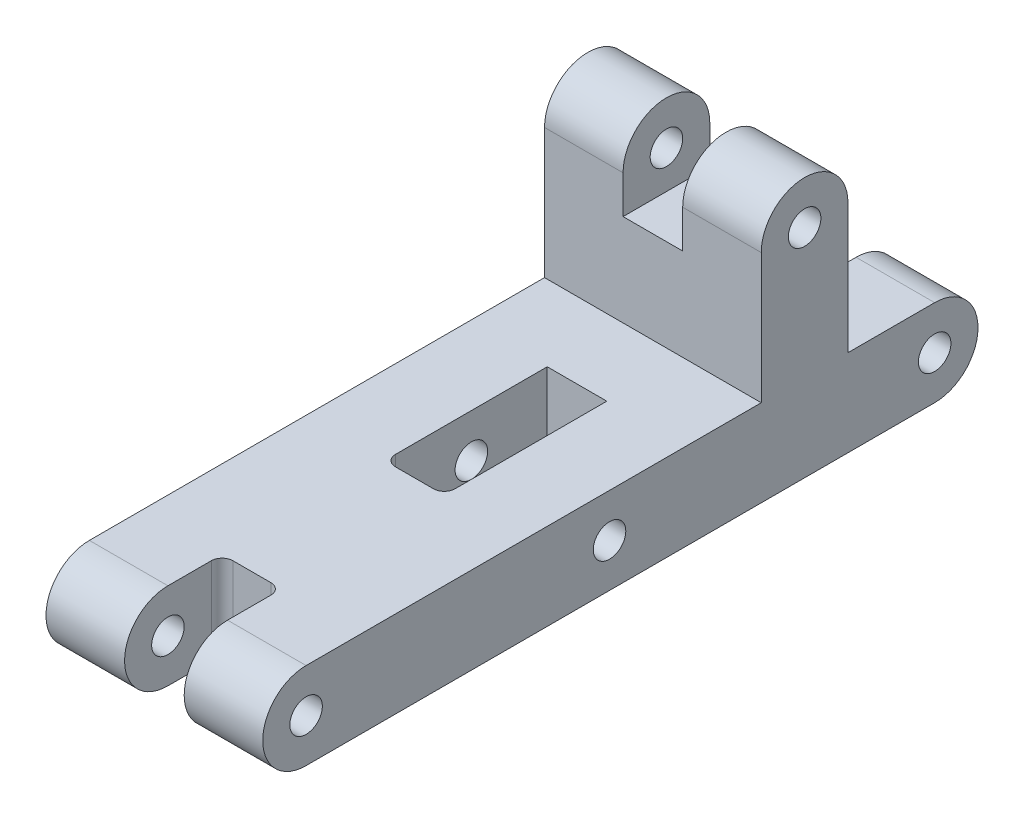
from build123d import *

# Parameters (mm, degrees)
CROQUIS1_R              = 1.5
SALIENTE_EXTRUIR1_DEPTH = 10
CROQUIS2_W              = 8
CROQUIS2_H              = 7.5
CROQUIS2_W_2            = 15
CROQUIS2_H_2            = 8
CROQUIS2_W_3            = 9
CORTAR_EXTRUIR1_DEPTH   = 2.75
REDONDEO1_R             = 1


with BuildPart() as part:
    # Croquis1 → Saliente-Extruir1 (new, symmetric)
    with BuildSketch(Plane(origin=(0, 0, 0), x_dir=(0, 0, -1), z_dir=(1, 0, 0))):
        with BuildLine():
            Line((-15, 4), (-1, 4))
            Line((-1, 4), (-1, 16))
            ThreePointArc((-1, 16), (3, 20), (7, 16))
            Line((7, 16), (7, 4))
            Line((7, 4), (15, 4))
            ThreePointArc((15, 4), (19, 0), (15, -4))
            Line((15, -4), (-15, -4))
            Line((-15, -4), (-43, -4))
            ThreePointArc((-43, -4), (-47, 0), (-43, 4))
            Line((-43, 4), (-15, 4))
        make_face()
        with Locations((15, 0)):
            Circle(CROQUIS1_R, mode=Mode.SUBTRACT)
        with Locations((3, 16)):
            Circle(CROQUIS1_R, mode=Mode.SUBTRACT)
        with Locations((-15, 0)):
            Circle(CROQUIS1_R, mode=Mode.SUBTRACT)
        with Locations((-43, 0)):
            Circle(CROQUIS1_R, mode=Mode.SUBTRACT)
    extrude(amount=SALIENTE_EXTRUIR1_DEPTH, both=True)

    # Croquis2 → Cortar-Extruir1 (cut, symmetric)
    with BuildSketch(Plane(origin=(0, 0, 0), x_dir=(0, 0, -1), z_dir=(1, 0, 0))):
        with Locations((3, 16.25)):
            Rectangle(CROQUIS2_W, CROQUIS2_H)
        with Locations((-15.5, 0)):
            Rectangle(CROQUIS2_W_2, CROQUIS2_H_2)
        with Locations((14.5, 0)):
            Rectangle(CROQUIS2_W_3, CROQUIS2_H_2)
        with Locations((-42.5, 0)):
            Rectangle(CROQUIS2_W_3, CROQUIS2_H_2)
    extrude(amount=CORTAR_EXTRUIR1_DEPTH, both=True, mode=Mode.SUBTRACT)

    # Redondeo1
    redondeo1_edges = [part.edges().sort_by_distance(p)[0] for p in [
        (2.75, 0, 23),
        (-2.75, 0, 23),
        (2.75, 0, 38),
        (-2.75, 0, 38),
        (2.75, 0, -10),
        (-2.75, 0, -10),
    ]]
    fillet(redondeo1_edges, radius=REDONDEO1_R)


solid = part.part
